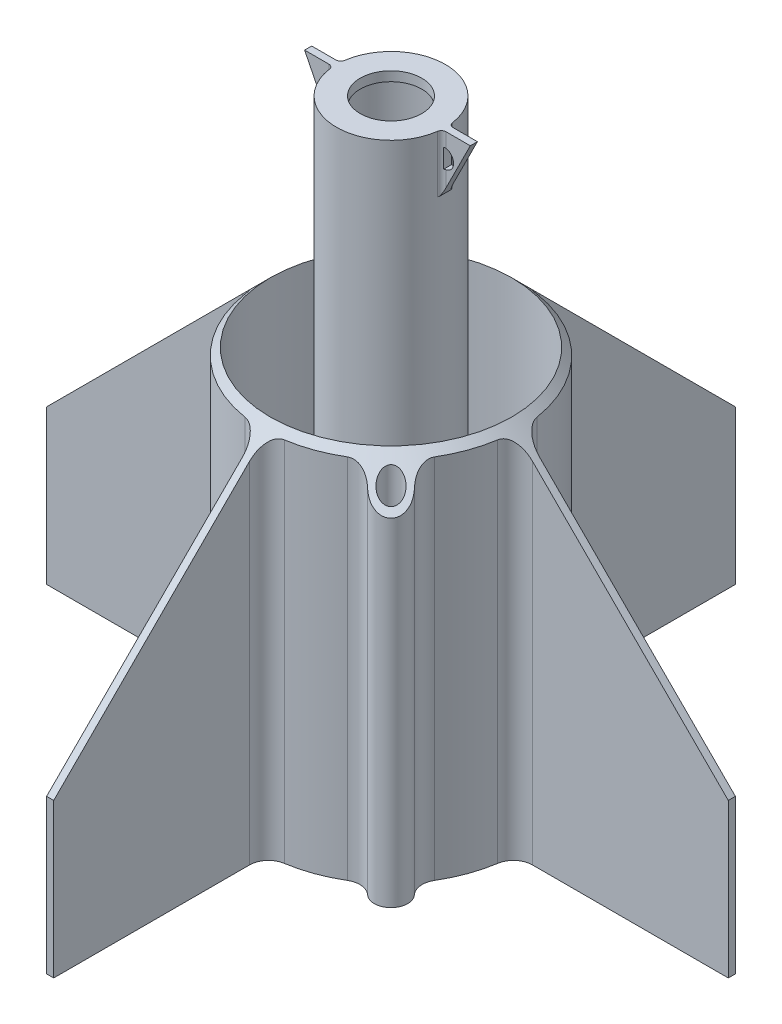
from build123d import *

# Parameters (mm, degrees)
BOSS_EXTRUDE1_DEPTH = 0.75
CIRPATTERN1_COUNT   = 4
BOSS_EXTRUDE2_DEPTH = 0.75
CUT_EXTRUDE2_DEPTH  = 162.559779958
BOSS_EXTRUDE3_DEPTH = 80
SKETCH9_R           = 2.25
CUT_EXTRUDE3_DEPTH  = 162.223447426
FILLET2_R           = 4
FILLET3_R           = 6
FILLET4_R           = 6
FILLET8_R           = 1


with BuildPart() as part:
    # Sketch1 → Revolve2 (revolve)
    with BuildSketch(Plane.XY, mode=Mode.PRIVATE) as revolve2_sk:
        Polygon((6.5, 125), (11.5, 125), (11.5, 2), (25.5, 2), (25.5, 80), (27, 80), (27, 0), (10.35, 0), (10.35, 123), (6.5, 123), align=None)
    revolve(revolve2_sk.sketch.rotate(Axis((0, 0, 0), (0, 1, 0)), 90), axis=Axis((0, 0, 0), (0, 1, 0)))

    # Sketch3 → Boss-Extrude1 (add, symmetric)
    with BuildSketch(Plane(origin=(0, 0, 0), x_dir=(0, 0, -1), z_dir=(1, 0, 0))):
        Polygon((-27, 80), (-72, 80), (-72, 0), (-26, 0), (-26, 80), align=None)
    boss_extrude1 = extrude(amount=BOSS_EXTRUDE1_DEPTH, both=True)

    # CirPattern1: Boss-Extrude1 ×4 about axis
    cirpattern1_axis = Axis((0, 0, 0), (0, 1, 0))
    for i in range(1, CIRPATTERN1_COUNT):
        add(boss_extrude1.rotate(cirpattern1_axis, i * 360 / CIRPATTERN1_COUNT))

    # Sketch4 → Boss-Extrude2 (add, symmetric)
    with BuildSketch(Plane.XY):
        Polygon((11.5, 125), (17.5, 125), (11.5, 113), (10.5, 113), (10.5, 125), align=None)
    boss_extrude2 = extrude(amount=BOSS_EXTRUDE2_DEPTH, both=True)

    # Sketch5 → Cut-Extrude2 (cut, symmetric)
    with BuildSketch(Plane.XY.offset(0.75)):
        with BuildLine():
            Line((11.975517418, 122), (11.975517418, 118))
            ThreePointArc((11.975517418, 118), (13.975517418, 120), (11.975517418, 122))
        make_face()
    cut_extrude2 = extrude(amount=CUT_EXTRUDE2_DEPTH, both=True, mode=Mode.SUBTRACT)

    # Mirror1: Boss-Extrude2, Cut-Extrude2 across plane
    add(boss_extrude2.mirror(Plane(origin=(0, 0, 0), x_dir=(0, 0, 1), z_dir=(1, 0, 0))))
    add(cut_extrude2.mirror(Plane(origin=(0, 0, 0), x_dir=(0, 0, 1), z_dir=(1, 0, 0))), mode=Mode.SUBTRACT)

    # Sketch8 → Boss-Extrude3 (add)
    with BuildSketch(Plane(origin=(0, 0, 0), x_dir=(1, 0, 0), z_dir=(0, 1, 0))):
        with BuildLine():
            Line((15.909902577, -20.859650045), (18.561553006, -23.511300474))
            ThreePointArc((18.561553006, -23.511300474), (23.511300474, -23.511300474), (23.511300474, -18.561553006))
            Line((23.511300474, -18.561553006), (20.859650045, -15.909902577))
            Line((20.859650045, -15.909902577), (15.909902577, -20.859650045))
        make_face()
    boss_extrude3 = extrude(amount=BOSS_EXTRUDE3_DEPTH)

    # Sketch9 → Cut-Extrude3 (cut, symmetric)
    with BuildSketch(Plane.XZ):
        with Locations(Location((21.03642674, 21.03642674, 0), (0, 0, 270))):
            Circle(SKETCH9_R)
    cut_extrude3 = extrude(amount=CUT_EXTRUDE3_DEPTH, both=True, mode=Mode.SUBTRACT)

    # Mirror2: Boss-Extrude3, Cut-Extrude3 across plane
    add(boss_extrude3.mirror(Plane(origin=(0, 0, 0), x_dir=(-0.7071067811865464, 0, 0.7071067811865487), z_dir=(0.7071067811865487, 0, 0.7071067811865464))))
    add(cut_extrude3.mirror(Plane(origin=(0, 0, 0), x_dir=(-0.7071067811865464, 0, 0.7071067811865487), z_dir=(0.7071067811865487, 0, 0.7071067811865464))), mode=Mode.SUBTRACT)

    # Sketch10 → Cut-Revolve1 (revolve, cut)
    with BuildSketch(Plane.XY, mode=Mode.PRIVATE) as cut_revolve1_sk:
        Polygon((24.989581323, 85), (77, 85), (77, 27.489581323), (24.989581323, 79.5), align=None)
    revolve(cut_revolve1_sk.sketch.rotate(Axis((0, 125, 0), (0, -1, 0)), 270), axis=Axis((0, 125, 0), (0, -1, 0)), mode=Mode.SUBTRACT)

    # Fillet2
    fillet2_edges = [part.edges().sort_by_distance(p)[0] for p in [
        (-0.75, 38.744790662, 26.989581323),
        (0.75, 38.744790662, 26.989581323),
        (26.989581323, 38.744790662, 0.75),
        (0.75, 38.744790662, -26.989581323),
        (-26.989581323, 38.744790662, 0.75),
        (-26.989581323, 38.744790662, -0.75),
        (-0.75, 38.744790662, -26.989581323),
        (-16.455921283, 38.744790662, -21.405668752),
        (26.989581323, 38.744790662, -0.75),
        (16.455921283, 38.744790662, 21.405668752),
        (21.405668752, 38.744790662, 16.455921283),
        (-21.405668752, 38.744790662, -16.455921283),
    ]]
    fillet(fillet2_edges, radius=FILLET2_R)

    # Fillet3
    fillet3_edges = [part.edges().sort_by_distance(p)[0] for p in [
        (0, 2, 25.5),
    ]]
    fillet(fillet3_edges, radius=FILLET3_R)

    # Fillet4
    fillet4_edges = [part.edges().sort_by_distance(p)[0] for p in [
        (0, 2, 11.5),
    ]]
    fillet(fillet4_edges, radius=FILLET4_R)

    # Fillet8
    # the kernel refuses this fillet: 1 mm, written as the material it adds along each edge
    with BuildSketch(Plane(origin=(11.475517418, 125, 0.75), x_dir=(-0.10268126600173223, 0, 0.9947143095443443), z_dir=(0, -1, 0))) as fillet8_piece_1_section:
        with BuildLine():
            CenterArc((0.902159842, -0.999293246), FILLET8_R, 92.154255508, 81.952153753)
            Line((-0.092554468, -0.89661198), (0, 0))
            ThreePointArc((0, 0), (0.432284924, -0.008127666), (0.864569849, 0))
        make_face()
    fillet8_piece_1 = extrude(amount=12, mode=Mode.PRIVATE)
    fillet8_piece_1 = split(fillet8_piece_1, bisect_by=Plane(origin=(15.718708831, 121.437417662, 0.952736352), z_dir=(-0.8944271909999161, 0.44721359549995765, 0)), keep=Keep.TOP, mode=Mode.PRIVATE)
    fillet8_piece_1 = fillet8_piece_1 - Plane(origin=(11.975517418, 120, 0.952736352), x_dir=(0, -1, 0), z_dir=(0, 0, 1)) * Cylinder(2, 28, mode=Mode.PRIVATE)
    add(fillet8_piece_1)
    with BuildSketch(Plane(origin=(11.475517418, 125, 0.75), x_dir=(-0.10268126600173223, 0, 0.9947143095443443), z_dir=(0, -1, 0))) as fillet8_piece_2_section:
        with BuildLine():
            CenterArc((0.902159842, -0.999293246), FILLET8_R, 92.154255508, 81.952153753)
            Line((-0.092554468, -0.89661198), (0, 0))
            ThreePointArc((0, 0), (0.432284924, -0.008127666), (0.864569849, 0))
        make_face()
    fillet8_piece_2 = extrude(amount=12, mode=Mode.PRIVATE)
    fillet8_piece_2 = split(fillet8_piece_2, bisect_by=Plane(origin=(14.326294946, 118.652589892, 0.950712875), z_dir=(-0.8944271909999161, 0.44721359549995765, 0)), keep=Keep.TOP, mode=Mode.PRIVATE)
    fillet8_piece_2 = split(fillet8_piece_2, bisect_by=Plane(origin=(11.975517418, 119.999999793, 0.950712875), z_dir=(-1, 0, 0)), keep=Keep.TOP, mode=Mode.PRIVATE)
    add(fillet8_piece_2)
    with BuildSketch(Plane(origin=(11.475517418, 125, -0.75), x_dir=(-0.1026812660017318, 0, -0.9947143095443443), z_dir=(0, -1, 0))) as fillet8_piece_3_section:
        with BuildLine():
            CenterArc((0.902159842, 0.999293246), FILLET8_R, 185.893590739, 81.952153753)
            Line((-0.092554468, 0.89661198), (0, 0))
            ThreePointArc((0, 0), (0.432284924, 0.008127666), (0.864569849, 0))
        make_face()
    fillet8_piece_3 = extrude(amount=12, mode=Mode.PRIVATE)
    fillet8_piece_3 = split(fillet8_piece_3, bisect_by=Plane(origin=(15.718708831, 121.437417662, -0.952736352), z_dir=(-0.8944271909999161, 0.44721359549995765, 0)), keep=Keep.TOP, mode=Mode.PRIVATE)
    fillet8_piece_3 = fillet8_piece_3 - Plane(origin=(11.975517418, 120, -0.952736352), x_dir=(0, -1, 0), z_dir=(0, 0, 1)) * Cylinder(2, 28, mode=Mode.PRIVATE)
    add(fillet8_piece_3)
    with BuildSketch(Plane(origin=(11.475517418, 125, -0.75), x_dir=(-0.1026812660017318, 0, -0.9947143095443443), z_dir=(0, -1, 0))) as fillet8_piece_4_section:
        with BuildLine():
            CenterArc((0.902159842, 0.999293246), FILLET8_R, 185.893590739, 81.952153753)
            Line((-0.092554468, 0.89661198), (0, 0))
            ThreePointArc((0, 0), (0.432284924, 0.008127666), (0.864569849, 0))
        make_face()
    fillet8_piece_4 = extrude(amount=12, mode=Mode.PRIVATE)
    fillet8_piece_4 = split(fillet8_piece_4, bisect_by=Plane(origin=(14.326294946, 118.652589892, -0.950712875), z_dir=(-0.8944271909999161, 0.44721359549995765, 0)), keep=Keep.TOP, mode=Mode.PRIVATE)
    fillet8_piece_4 = split(fillet8_piece_4, bisect_by=Plane(origin=(11.975517418, 119.999999793, -0.950712875), z_dir=(-1, 0, 0)), keep=Keep.TOP, mode=Mode.PRIVATE)
    add(fillet8_piece_4)
    with BuildSketch(Plane(origin=(-11.475517418, 125, 0.75), x_dir=(0.1026812660017337, 0, 0.994714309544344), z_dir=(0, -1, 0))) as fillet8_piece_5_section:
        with BuildLine():
            CenterArc((0.902159842, 0.999293246), FILLET8_R, 185.893590739, 81.952153753)
            Line((-0.092554468, 0.89661198), (0, 0))
            ThreePointArc((0, 0), (0.432284924, 0.008127666), (0.864569849, 0))
        make_face()
    fillet8_piece_5 = extrude(amount=12, mode=Mode.PRIVATE)
    fillet8_piece_5 = split(fillet8_piece_5, bisect_by=Plane(origin=(-15.718708831, 121.437417662, 0.952736352), z_dir=(0.8944271909999161, 0.44721359549995765, 0)), keep=Keep.TOP, mode=Mode.PRIVATE)
    fillet8_piece_5 = fillet8_piece_5 - Plane(origin=(-11.975517418, 120, 0.952736352), x_dir=(0, -1, 0), z_dir=(0, 0, 1)) * Cylinder(2, 28, mode=Mode.PRIVATE)
    add(fillet8_piece_5)
    with BuildSketch(Plane(origin=(-11.475517418, 125, 0.75), x_dir=(0.1026812660017337, 0, 0.994714309544344), z_dir=(0, -1, 0))) as fillet8_piece_6_section:
        with BuildLine():
            CenterArc((0.902159842, 0.999293246), FILLET8_R, 185.893590739, 81.952153753)
            Line((-0.092554468, 0.89661198), (0, 0))
            ThreePointArc((0, 0), (0.432284924, 0.008127666), (0.864569849, 0))
        make_face()
    fillet8_piece_6 = extrude(amount=12, mode=Mode.PRIVATE)
    fillet8_piece_6 = split(fillet8_piece_6, bisect_by=Plane(origin=(-14.326294946, 118.652589892, 0.950712875), z_dir=(0.8944271909999161, 0.44721359549995765, 0)), keep=Keep.TOP, mode=Mode.PRIVATE)
    fillet8_piece_6 = split(fillet8_piece_6, bisect_by=Plane(origin=(-11.975517418, 119.999999793, 0.950712875), z_dir=(1, 0, 0)), keep=Keep.TOP, mode=Mode.PRIVATE)
    add(fillet8_piece_6)
    with BuildSketch(Plane(origin=(-11.475517418, 125, -0.75), x_dir=(0.10268126600173179, 0, -0.9947143095443443), z_dir=(0, -1, 0))) as fillet8_piece_7_section:
        with BuildLine():
            CenterArc((0.902159842, -0.999293246), FILLET8_R, 92.154255508, 81.952153753)
            Line((-0.092554468, -0.89661198), (0, 0))
            ThreePointArc((0, 0), (0.432284924, -0.008127666), (0.864569849, 0))
        make_face()
    fillet8_piece_7 = extrude(amount=12, mode=Mode.PRIVATE)
    fillet8_piece_7 = split(fillet8_piece_7, bisect_by=Plane(origin=(-15.718708831, 121.437417662, -0.952736352), z_dir=(0.8944271909999161, 0.44721359549995765, 0)), keep=Keep.TOP, mode=Mode.PRIVATE)
    fillet8_piece_7 = fillet8_piece_7 - Plane(origin=(-11.975517418, 120, -0.952736352), x_dir=(0, -1, 0), z_dir=(0, 0, 1)) * Cylinder(2, 28, mode=Mode.PRIVATE)
    add(fillet8_piece_7)
    with BuildSketch(Plane(origin=(-11.475517418, 125, -0.75), x_dir=(0.10268126600173179, 0, -0.9947143095443443), z_dir=(0, -1, 0))) as fillet8_piece_8_section:
        with BuildLine():
            CenterArc((0.902159842, -0.999293246), FILLET8_R, 92.154255508, 81.952153753)
            Line((-0.092554468, -0.89661198), (0, 0))
            ThreePointArc((0, 0), (0.432284924, -0.008127666), (0.864569849, 0))
        make_face()
    fillet8_piece_8 = extrude(amount=12, mode=Mode.PRIVATE)
    fillet8_piece_8 = split(fillet8_piece_8, bisect_by=Plane(origin=(-14.326294946, 118.652589892, -0.950712875), z_dir=(0.8944271909999161, 0.44721359549995765, 0)), keep=Keep.TOP, mode=Mode.PRIVATE)
    fillet8_piece_8 = split(fillet8_piece_8, bisect_by=Plane(origin=(-11.975517418, 119.999999793, -0.950712875), z_dir=(1, 0, 0)), keep=Keep.TOP, mode=Mode.PRIVATE)
    add(fillet8_piece_8)


solid = part.part
